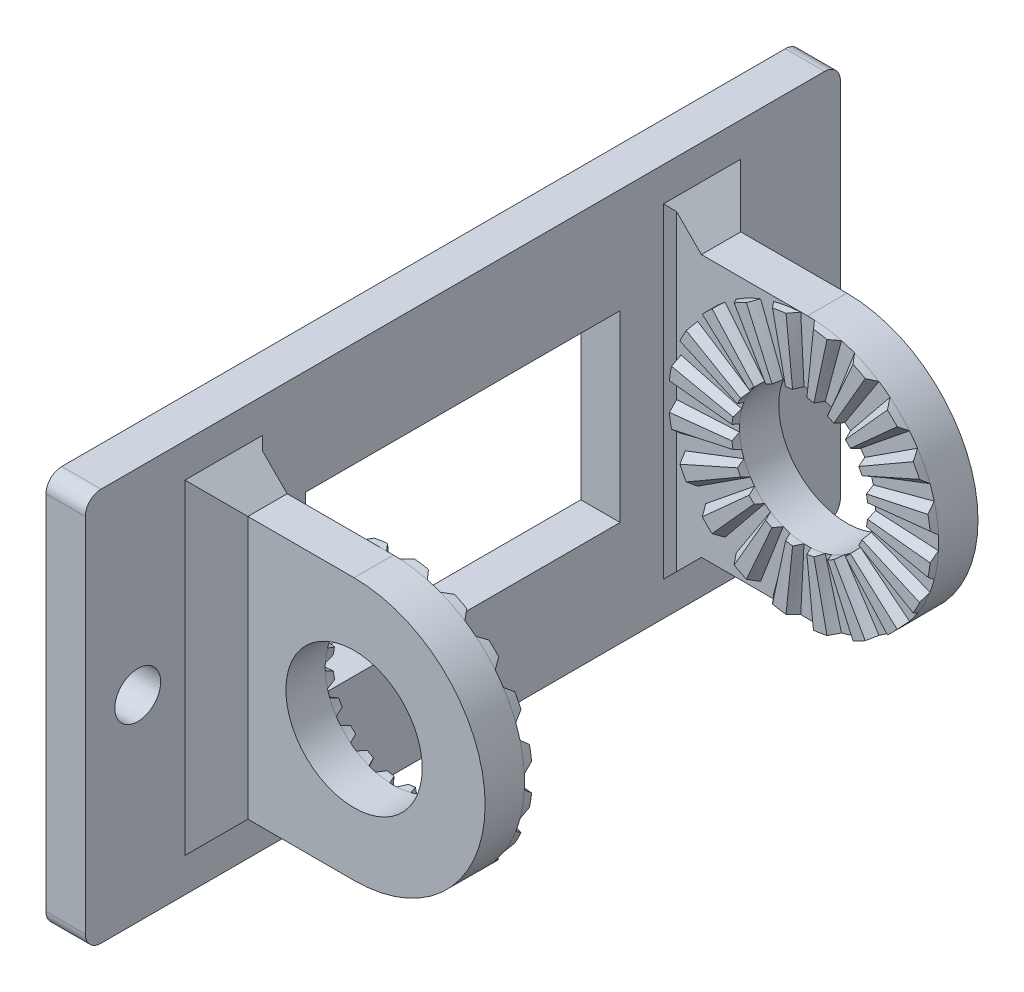
from build123d import *

# Parameters (mm, degrees)
EXTRUDE_1_DEPTH          = 18.8
SKETCH_2_W               = 57.6
SKETCH_2_H               = 30
EXTRUDE_2_DEPTH          = 3
CUT_EXTRUDE_1_REACH      = 40.402
SKETCH_3_W               = 31.6
SKETCH_3_H               = 20
SKETCH_4_R               = 5.2
CUT_EXTRUDE_2_DEPTH      = 52.701160529
SKETCH_7_W               = 24
SKETCH_7_H               = 14
CUT_EXTRUDE_3_DEPTH      = 39.401692671
SKETCH_8_R               = 1.75
CUT_EXTRUDE_4_DEPTH      = 39.401692671
PATTERN_CIRCULAR_1_COUNT = 20
CHAMFER_1_SIZE           = 2.4
CHAMFER_2_SIZE           = 0.5
FILLET_1_R               = 1.2


# Read off the part's stored shape, not the designer's step: Зеркальное отражение1
with BuildPart() as part:
    # Эскиз1 → Бобышка-Вытянуть1 (new, symmetric)
    with BuildSketch(Plane.XY):
        with BuildLine():
            Line((0, 10), (-10.5, 10))
            Line((-10.5, 10), (-10.5, -10))
            Line((-10.5, -10), (0, -10))
            ThreePointArc((0, -10), (10, 0), (0, 10))
        make_face()
    extrude(amount=EXTRUDE_1_DEPTH, both=True)

    # Эскиз2 → Бобышка-Вытянуть2 (add)
    with BuildSketch(Plane.ZY.offset(10.5)):
        Rectangle(SKETCH_2_W, SKETCH_2_H)
    extrude(amount=EXTRUDE_2_DEPTH)

    # Эскиз3 → Вырез-Вытянуть1 (cut, up to next)
    with BuildSketch(Plane(origin=(-10.5, 0, 0), x_dir=(0, 0, -1), z_dir=(1, 0, 0)), mode=Mode.PRIVATE) as cut_extrude_1_sk1:
        Rectangle(SKETCH_3_W, SKETCH_3_H)
    cut_extrude_1_tool1 = extrude(cut_extrude_1_sk1.sketch, amount=CUT_EXTRUDE_1_REACH, mode=Mode.PRIVATE) & part.part
    add(cut_extrude_1_tool1.solids().sort_by_distance((-10.5, 0, 0))[0], mode=Mode.SUBTRACT)

    # Эскиз4 → Вырез-Вытянуть2 (cut, through all)
    with BuildSketch(Plane(origin=(0, 0, -18.8), x_dir=(-1, 0, 0), z_dir=(0, 0, -1))):
        Circle(SKETCH_4_R)
    extrude(amount=-CUT_EXTRUDE_2_DEPTH, mode=Mode.SUBTRACT)

    # Эскиз7 → Вырез-Вытянуть3 (cut, through all)
    with BuildSketch(Plane(origin=(-10.5, 0, 0), x_dir=(0, 0, -1), z_dir=(1, 0, 0))):
        Rectangle(SKETCH_7_W, SKETCH_7_H)
    extrude(amount=-CUT_EXTRUDE_3_DEPTH, mode=Mode.SUBTRACT)

    # Эскиз8 → Вырез-Вытянуть4 (cut, through all)
    with BuildSketch(Plane(origin=(-10.5, 0, 0), x_dir=(0, 0, -1), z_dir=(1, 0, 0))):
        with Locations((-24.8, 0)):
            Circle(SKETCH_8_R)
        with Locations((24.8, 0)):
            Circle(SKETCH_8_R)
    extrude(amount=-CUT_EXTRUDE_4_DEPTH, mode=Mode.SUBTRACT)

    # Эскиз6 for По сечениям1 → По сечениям1 section 0
    with BuildSketch(Plane(origin=(0, 0, 15.2), x_dir=(-1, 0, 0), z_dir=(0, 0, -1))):
        with BuildLine():
            Line((-9.945218954, -1.045284633), (-5.171513856, -0.543548009))
            # circular arc as an exact rational Bezier (weights 1, cos(half-angle), 1)
            Bezier((-5.171513856, -0.543548009), (-5.143027712, -0.814575566), (-5.086367524, -1.081140792), weights=[1, 0.998629535, 1])
            Line((-5.086367524, -1.081140792), (-9.781476007, -2.079116908))
            Bezier((-9.781476007, -2.079116908), (-9.890437907, -1.566491473), (-9.945218954, -1.045284633), weights=[1, 0.998629535, 1])
        make_face()
    # Эскиз5 for По сечениям1 → По сечениям1 section 1
    with BuildSketch(Plane(origin=(0, 0, 15.8), x_dir=(-1, 0, 0), z_dir=(0, 0, -1))):
        with BuildLine():
            Line((-9.986295348, -0.523359562), (-5.192873581, -0.272146972))
            Bezier((-5.192873581, -0.272146972), (-5.164269781, -0.817939979), (-5.022814297, -1.345859035), weights=[1, 0.994521895, 1])
            Line((-5.022814297, -1.345859035), (-9.659258263, -2.588190451))
            Bezier((-9.659258263, -2.588190451), (-9.931288041, -1.572961498), (-9.986295348, -0.523359562), weights=[1, 0.994521895, 1])
        make_face()
    loft_1 = loft()

    # Круговой массив1: По сечениям1 ×20 about axis
    pattern_circular_1_axis = Axis((0, 0, 28.8), (0, 0, -1))
    for i in range(1, PATTERN_CIRCULAR_1_COUNT):
        add(loft_1.rotate(pattern_circular_1_axis, i * 360 / PATTERN_CIRCULAR_1_COUNT))

    # Зеркальное отражение1: part across plane


with BuildPart() as part_1:
    add(part.part)
    add(part.part.mirror(Plane.XY))

    # Фаска1
    chamfer_1_edges = [part_1.edges().sort_by_distance(p)[0] for p in [
        (-10.5, 0, 18.8),
        (-10.5, 10, -17.3),
        (-10.5, -10, -17.3),
        (-10.5, 0, -18.8),
        (-10.5, -10, 17.3),
        (-10.5, 10, 17.3),
    ]]
    chamfer(chamfer_1_edges, length=CHAMFER_1_SIZE)

    # Фаска2
    chamfer_2_edges = [part_1.edges().sort_by_distance(p)[0] for p in [
        (-10.5, 0, 15.8),
        (-10.5, 0, -15.8),
    ]]
    chamfer(chamfer_2_edges, length=CHAMFER_2_SIZE)

    # Скругление1
    fillet_1_edges = [part_1.edges().sort_by_distance(p)[0] for p in [
        (-12, 15, -28.8),
        (-12, -15, -28.8),
        (-12, -15, 28.8),
        (-12, 15, 28.8),
    ]]
    fillet(fillet_1_edges, radius=FILLET_1_R)


solid = part_1.part
